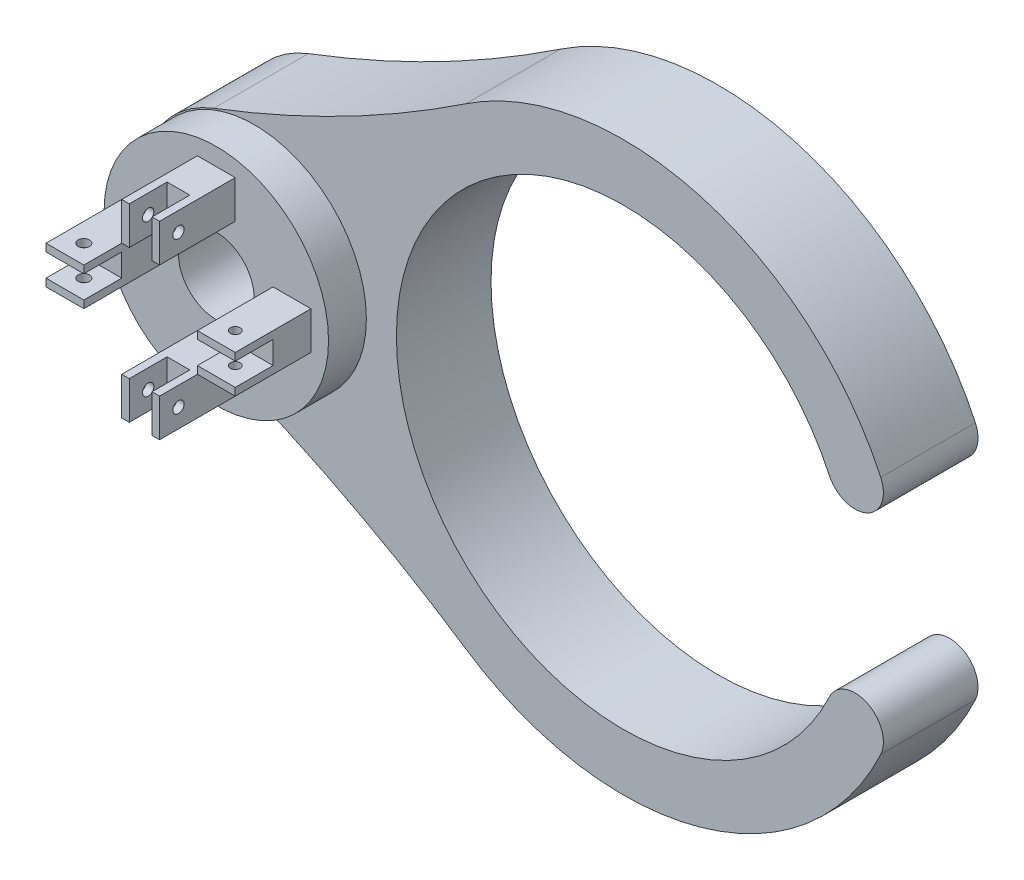
from build123d import *

# Parameters (mm, degrees)
BOSS_EXTRUDE1_DEPTH = 25
SKETCH1_3_R         = 29.652029199
BOSS_EXTRUDE2_DEPTH = 35
SKETCH3_R           = 10
CUT_EXTRUDE1_DEPTH  = 35
SKETCH4_W           = 10
SKETCH4_H           = 10
BOSS_EXTRUDE3_DEPTH = 20
SKETCH5_W           = 6
SKETCH5_H           = 10
SKETCH5_W_2         = 10
SKETCH5_H_2         = 6
CUT_EXTRUDE2_DEPTH  = 10
SKETCH6_R           = 1.3
SKETCH6_R_2         = 1.5
CUT_EXTRUDE3_DEPTH  = 10
SKETCH7_R           = 1.5
CUT_EXTRUDE4_DEPTH  = 10


with BuildPart() as part:
    # Sketch1 → Boss-Extrude1 (new body)
    with BuildSketch(Plane.XY):
        with BuildLine():
            ThreePointArc((-16.010570265, 46.959935857), (18.262261371, 31.665381218), (50.600725893, 12.618751535))
            ThreePointArc((50.600725893, 12.618751535), (112.455741461, 2.776716043), (160.210090254, 43.303630369))
            ThreePointArc((160.210090254, 43.303630369), (156.582418814, 53.270575735), (146.615473448, 49.642904296))
            ThreePointArc((146.615473448, 49.642904296), (32.237006226, 75), (146.615473448, 100.357095704))
            ThreePointArc((146.615473448, 100.357095704), (156.582418814, 96.729424265), (160.210090254, 106.696369631))
            ThreePointArc((160.210090254, 106.696369631), (112.455741461, 147.223283957), (50.600725893, 137.381248465))
            ThreePointArc((50.600725893, 137.381248465), (18.262261371, 118.334618782), (-16.010570265, 103.040064143))
            ThreePointArc((-16.010570265, 103.040064143), (-35.344980602, 75), (-16.010570265, 46.959935857))
        make_face()
    extrude(amount=BOSS_EXTRUDE1_DEPTH)

    # Sketch1<3> → Boss-Extrude2 (add)
    with BuildSketch(Plane.XY):
        with Locations((-5.344980602, 75)):
            Circle(SKETCH1_3_R)
    extrude(amount=BOSS_EXTRUDE2_DEPTH)

    # Sketch3 → Cut-Extrude1 (cut)
    with BuildSketch(Plane.XY.offset(35)):
        with Locations((-5.344980602, 75)):
            Circle(SKETCH3_R)
    extrude(amount=-CUT_EXTRUDE1_DEPTH, mode=Mode.SUBTRACT)

    # Sketch4 → Boss-Extrude3 (add)
    with BuildSketch(Plane.XY.offset(35)):
        with Locations((14.655019398, 75)):
            Rectangle(SKETCH4_W, SKETCH4_H)
        with Locations((-5.344980602, 55)):
            Rectangle(SKETCH4_W, SKETCH4_H)
        with Locations((-5.344980602, 95)):
            Rectangle(SKETCH4_W, SKETCH4_H)
        with Locations((-25.344980602, 75)):
            Rectangle(SKETCH4_W, SKETCH4_H)
    extrude(amount=BOSS_EXTRUDE3_DEPTH)

    # Sketch5 → Cut-Extrude2 (cut)
    with BuildSketch(Plane.XY.offset(55)):
        with Locations((-5.344980602, 95)):
            Rectangle(SKETCH5_W, SKETCH5_H)
        with Locations((14.655019398, 75)):
            Rectangle(SKETCH5_W_2, SKETCH5_H_2)
        with Locations((-5.344980602, 55)):
            Rectangle(SKETCH5_W, SKETCH5_H)
        with Locations((-25.344980602, 75)):
            Rectangle(SKETCH5_W_2, SKETCH5_H_2)
    extrude(amount=-CUT_EXTRUDE2_DEPTH, mode=Mode.SUBTRACT)

    # Sketch6 → Cut-Extrude3 (cut)
    with BuildSketch(Plane(origin=(0, 70, 0), x_dir=(-1, 0, 0), z_dir=(0, -1, 0))):
        with Locations((-14.655019398, -50)):
            Circle(SKETCH6_R)
        with Locations((25.344980602, -50)):
            Circle(SKETCH6_R_2)
    extrude(amount=-CUT_EXTRUDE3_DEPTH, mode=Mode.SUBTRACT)

    # Sketch7 → Cut-Extrude4 (cut)
    with BuildSketch(Plane.ZY.offset(10.344980602)):
        with Locations((50, 55)):
            Circle(SKETCH7_R)
        with Locations((50, 95)):
            Circle(SKETCH7_R)
    extrude(amount=-CUT_EXTRUDE4_DEPTH, mode=Mode.SUBTRACT)


solid = part.part
